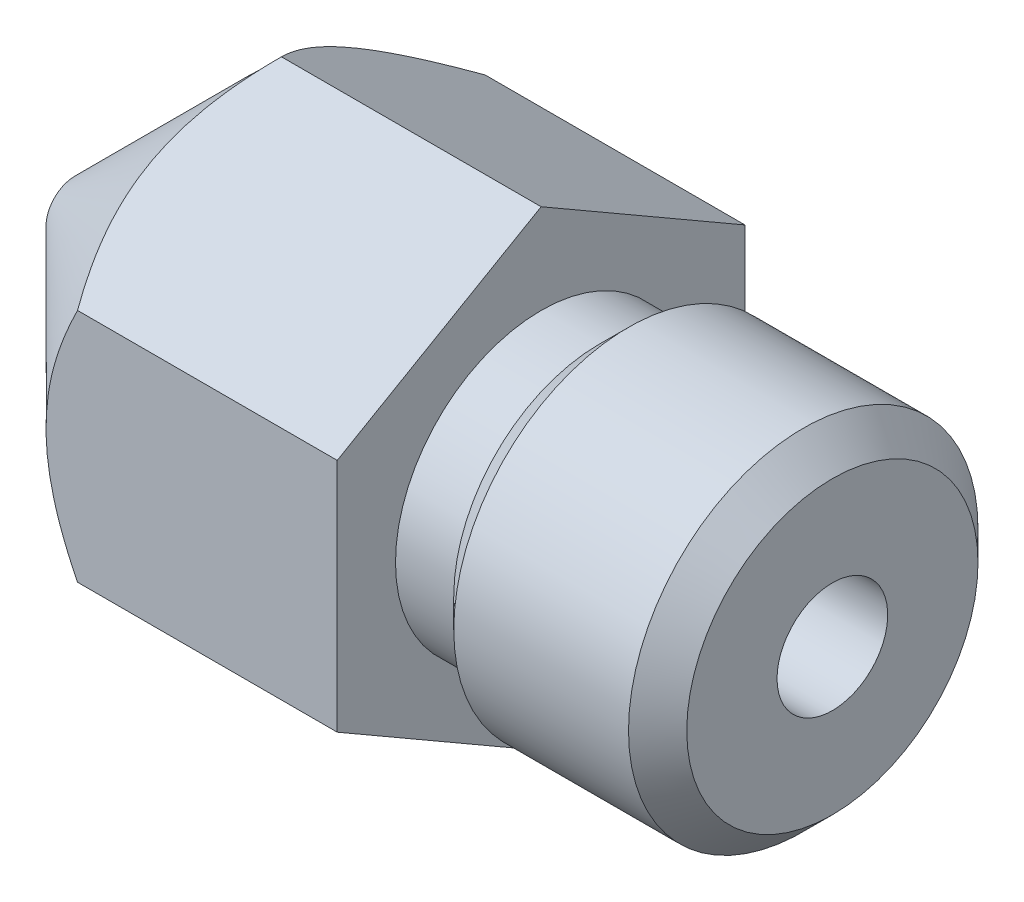
from build123d import *

# Parameters (mm, degrees)
ESQUISSE2_OUTSIDE_W     = 14.638
ESQUISSE2_OUTSIDE_H     = 14.638
ENL_V_MAT_EXTRU_1_DEPTH = 10
CHANFREIN1_SIZE         = 0.5


with BuildPart() as part:
    # Esquisse1 → Révolution1 (revolve)
    with BuildSketch(Plane.XY, mode=Mode.PRIVATE) as r_volution1_sk:
        Polygon((1.25, 0.2), (2, 0.95), (13, 0.95), (13, 3), (9, 3), (9, 2.5), (8, 2.5), (8, 4.5), (4, 4.5), (0, 0.5), (0, 0.2), align=None)
    revolve(r_volution1_sk.sketch.rotate(Axis((0, 0, 0), (1, 0, 0)), 90), axis=Axis((0, 0, 0), (1, 0, 0)))

    # Esquisse2 outside → Enlèv. mat.-Extru.1 (cut)
    with BuildSketch(Plane(origin=(8, 0, 0), x_dir=(0, 0, -1), z_dir=(1, 0, 0))):
        Rectangle(ESQUISSE2_OUTSIDE_W, ESQUISSE2_OUTSIDE_H)
        Polygon((-3.5, -2.020725942), (0, -4.041451884), (3.5, -2.020725942), (3.5, 2.020725942), (0, 4.041451884), (-3.5, 2.020725942), align=None, mode=Mode.SUBTRACT)
    extrude(amount=-ENL_V_MAT_EXTRU_1_DEPTH, mode=Mode.SUBTRACT)

    # Chanfrein1
    chanfrein1_edges = [part.edges().sort_by_distance(p)[0] for p in [
        (9, 0, -3),
        (13, 0, -3),
    ]]
    chamfer(chanfrein1_edges, length=CHANFREIN1_SIZE - 0.0001)  # a hair under: the kernel refuses the full size


solid = part.part
